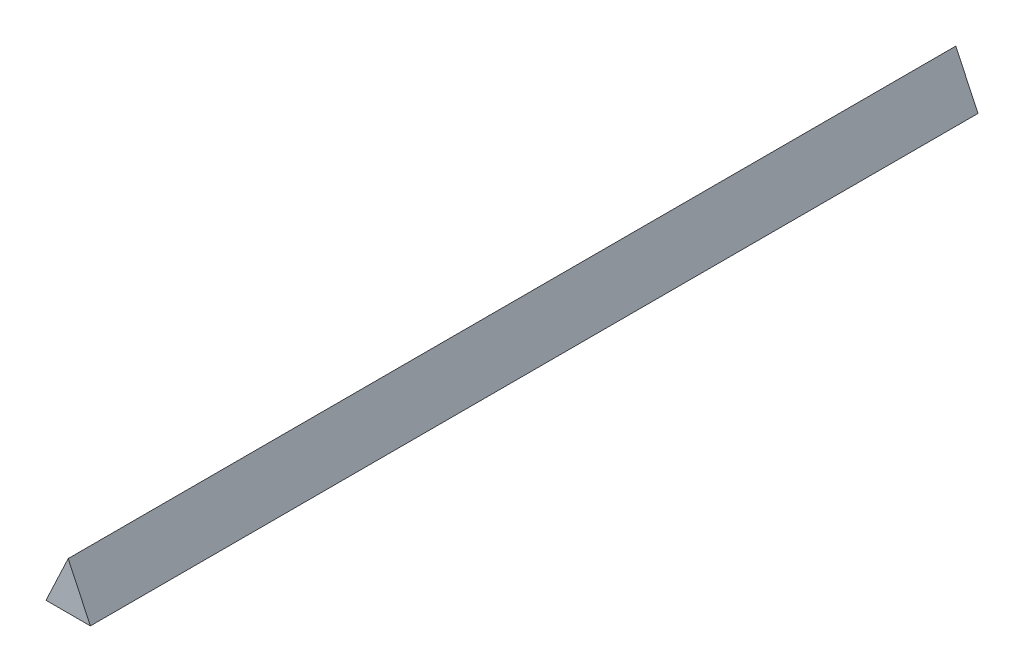
from build123d import *

# Parameters (mm, degrees)
EXTRUDE_1_DEPTH = 34


with BuildPart() as part:
    # Эскиз1 → Бобышка-Вытянуть1 (new body)
    with BuildSketch(Plane.XY):
        Polygon((-0.85, 0), (0.85, 0), (0, 1.810386699), align=None)
    extrude(amount=EXTRUDE_1_DEPTH)


solid = part.part
